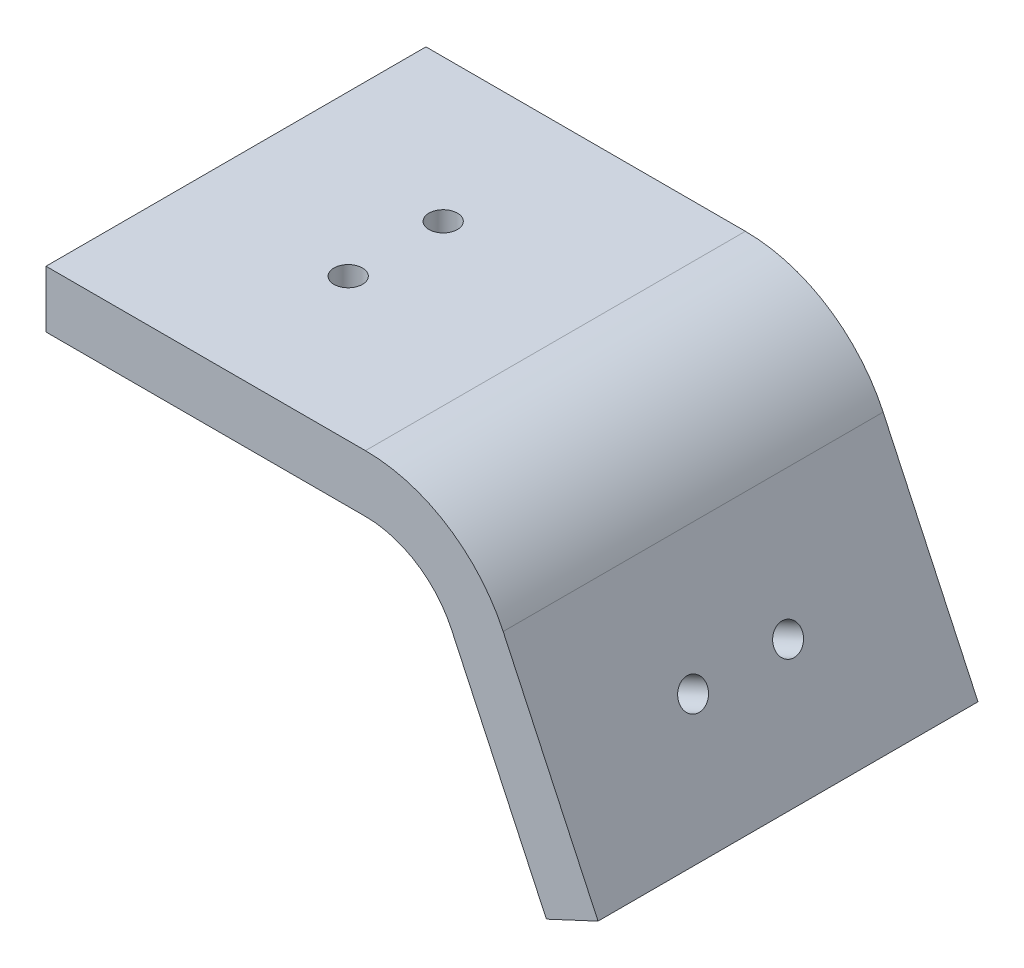
from build123d import *

# Parameters (mm, degrees)
BOSS_EXTRUDE1_DEPTH = 40
SKETCH2_R           = 1.5
CUT_EXTRUDE1_DEPTH  = 40
SKETCH3_R           = 1.5
CUT_EXTRUDE2_DEPTH  = 40


with BuildPart() as part:
    # Sketch1 → Boss-Extrude1 (new body)
    with BuildSketch(Plane.XY):
        with BuildLine():
            Line((0, 0), (-9.98617259, 21.415416229))
            ThreePointArc((-9.98617259, 21.415416229), (-13.676254377, 25.623148069), (-19.04925046, 27.189233611))
            Line((-19.04925046, 27.189233611), (-52.678547852, 27.189233611))
            Line((-52.678547852, 27.189233611), (-52.678547852, 33.189233611))
            Line((-52.678547852, 33.189233611), (-19.04925046, 33.189233611))
            ThreePointArc((-19.04925046, 33.189233611), (-10.452456727, 30.683496744), (-4.548325868, 23.951125799))
            Line((-4.548325868, 23.951125799), (5.437846722, 2.53570957))
            Line((5.437846722, 2.53570957), (0, 0))
        make_face()
    extrude(amount=BOSS_EXTRUDE1_DEPTH)

    # Sketch2 → Cut-Extrude1 (cut)
    with BuildSketch(Plane(origin=(0, 33.189233611, 0), x_dir=(1, 0, 0), z_dir=(0, 1, 0))):
        with Locations((-35.863899156, -15)):
            Circle(SKETCH2_R)
        with Locations((-35.863899156, -25)):
            Circle(SKETCH2_R)
    extrude(amount=-CUT_EXTRUDE1_DEPTH, mode=Mode.SUBTRACT)

    # Sketch3 → Cut-Extrude2 (cut)
    with BuildSketch(Plane(origin=(5.437846722, 2.53570957, 0), x_dir=(0, 0, -1), z_dir=(0.906307787036651, 0.42261826174069705, 0))):
        with Locations((-15, 11.814648696)):
            Circle(SKETCH3_R)
        with Locations((-25, 11.814648696)):
            Circle(SKETCH3_R)
    extrude(amount=-CUT_EXTRUDE2_DEPTH, mode=Mode.SUBTRACT)


solid = part.part
